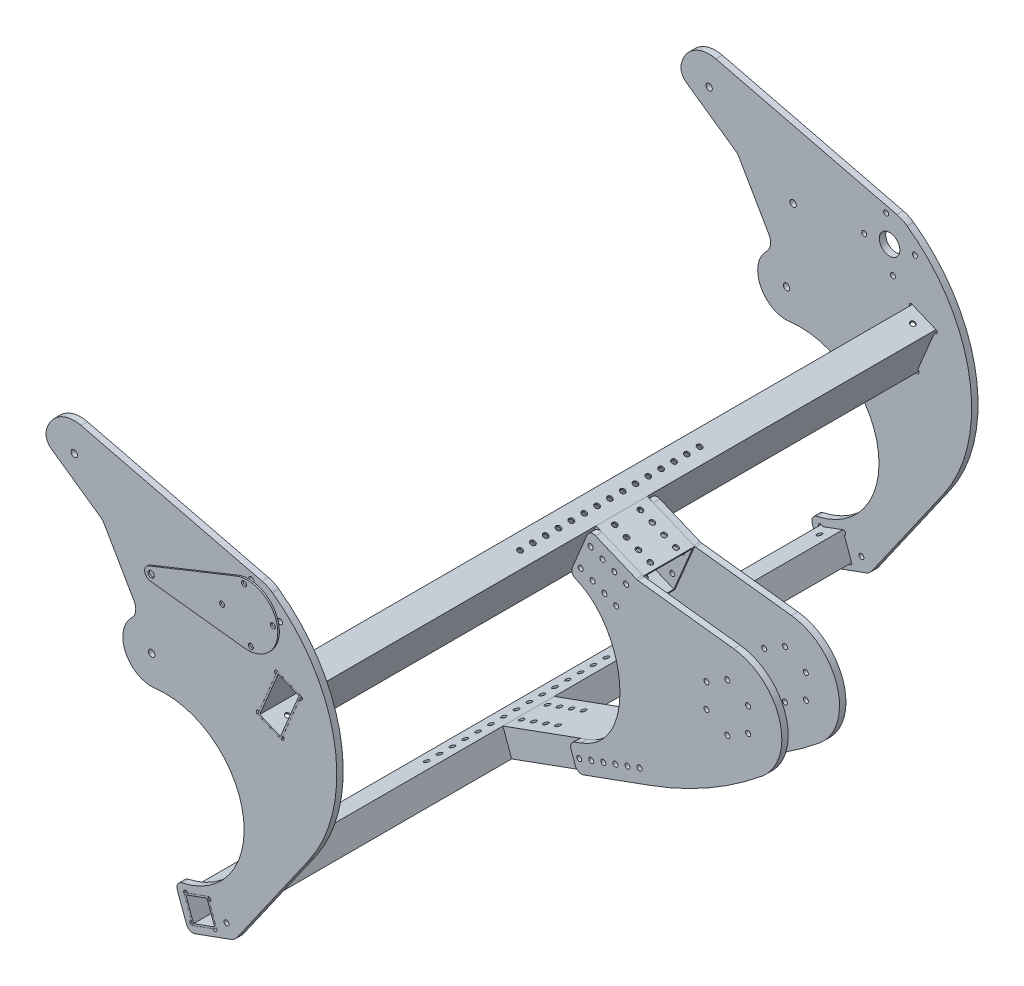
from build123d import *

# Parameters (mm, degrees)
INTAKEPLATE_R         = 2.4892
INTAKEPLATE_R_2       = 3.1877
INTAKEPLATE_R_3       = 10.16
INTAKE_PLATE_DEPTH    = 6.35
ATTACHPLATE_R         = 2.4892
ATTACH_PLATE_DEPTH    = 6.35
FILLET1_R             = 6.35
TUBES_DEPTH           = 317.5
TUBES_2_DEPTH         = 317.5
SHELL1_T              = -1.5875
SHELL2_T              = -1.5875
MOTORPLATE_R          = 3.1877
MOTORPLATE_R_2        = 2.4892
MOTOR_PLATE_DEPTH     = 0.79375
BOSS_EXTRUDE5_DEPTH   = 25.4
BOSS_EXTRUDE5_2_DEPTH = 25.4
SHELL3_T              = -1.5875
SHELL4_T              = -1.5875
SKETCH2_R             = 2.4892
CUT_EXTRUDE1_DEPTH    = 559.862765093
SKETCH3_R             = 2.4892
CUT_EXTRUDE2_DEPTH    = 551.133429097
SKETCH7_R             = 2.4892
CUT_EXTRUDE3_DEPTH    = 578.337440485


with BuildPart() as part:
    # intakeplate → intake plate (new body)
    with BuildSketch(Plane.XY.offset(311.15)):
        with BuildLine():
            Line((-175.094481696, 163.860501271), (-354.210813057, 207.74342033))
            ThreePointArc((-354.210813057, 207.74342033), (-376.184884819, 204.086805854), (-388.681665834, 185.646059572))
            ThreePointArc((-388.681665834, 185.646059572), (-387.982745567, 178.475563628), (-383.495650977, 172.839032447))
            Line((-383.495650977, 172.839032447), (-334.999642146, 138.88176149))
            ThreePointArc((-334.999642146, 138.88176149), (-332.918300109, 137.055971146), (-331.282076853, 134.82252795))
            Line((-331.282076853, 134.82252795), (-301.708711026, 83.535344783))
            ThreePointArc((-301.708711026, 83.535344783), (-300.141023582, 75.376599822), (-303.952427196, 67.994461531))
            ThreePointArc((-303.952427196, 67.994461531), (-310.0444736, 35.013836588), (-280.597550354, 18.960383305))
            ThreePointArc((-280.597550354, 18.960383305), (-193.811320702, -45.167346066), (-254.24067154, -134.568178774))
            ThreePointArc((-254.24067154, -134.568178774), (-258.462337263, -137.704576872), (-258.87162423, -142.947852441))
            Line((-258.87162423, -142.947852441), (-249.732572384, -168.057191023))
            ThreePointArc((-249.732572384, -168.057191023), (-246.449150204, -171.64041756), (-241.593696332, -171.852411255))
            Line((-241.593696332, -171.852411255), (-205.79140748, -158.821443794))
            ThreePointArc((-205.79140748, -158.821443794), (-202.401145166, -156.960902507), (-199.728004521, -154.166298503))
            Line((-199.728004521, -154.166298503), (-128.44973166, -52.256397469))
            ThreePointArc((-128.44973166, -52.256397469), (-103.13948243, 60.921918773), (-164.806500035, 159.141666906))
            ThreePointArc((-164.806500035, 159.141666906), (-169.725931453, 161.99066752), (-175.094481696, 163.860501271))
        make_face()
        with BuildLine():
            Line((-245.202008925, -161.938653884), (-252.487585129, -141.921697774))
            ThreePointArc((-252.487585129, -141.921697774), (-251.232472856, -139.230100819), (-248.5408759, -140.485213092))
            Line((-248.5408759, -140.485213092), (-228.523919791, -133.199636887))
            ThreePointArc((-228.523919791, -133.199636887), (-225.832322835, -134.454749161), (-227.087435109, -137.146346116))
            Line((-227.087435109, -137.146346116), (-219.801858904, -157.163302226))
            ThreePointArc((-219.801858904, -157.163302226), (-221.056971177, -159.854899181), (-223.748568133, -158.599786908))
            Line((-223.748568133, -158.599786908), (-243.765524242, -165.885363113))
            ThreePointArc((-243.765524242, -165.885363113), (-246.457121198, -164.630250839), (-245.202008925, -161.938653884))
        make_face(mode=Mode.SUBTRACT)
        with Locations((-210.135063301, -146.88734751)):
            Circle(INTAKEPLATE_R, mode=Mode.SUBTRACT)
        with Locations((-284.24632, 47.301468413)):
            Circle(INTAKEPLATE_R_2, mode=Mode.SUBTRACT)
        with Locations((-360.934946628, 180.29761311)):
            Circle(INTAKEPLATE_R_2, mode=Mode.SUBTRACT)
        with Locations((-277.709098928, 122.022247177)):
            Circle(INTAKEPLATE_R_2, mode=Mode.SUBTRACT)
        with Locations((-178.884103132, 109.544019413)):
            Circle(INTAKEPLATE_R, mode=Mode.SUBTRACT)
        with BuildLine():
            Line((-159.80685551, 94.370376565), (-136.277395988, 84.53695716))
            ThreePointArc((-136.277395988, 84.53695716), (-135.149557505, 81.789598183), (-137.896916482, 80.6617597))
            Line((-137.896916482, 80.6617597), (-154.285537336, 41.446978444))
            ThreePointArc((-154.285537336, 41.446978444), (-153.157698853, 38.699619467), (-155.90505783, 37.571780984))
            Line((-155.90505783, 37.571780984), (-179.434517351, 47.405200389))
            ThreePointArc((-179.434517351, 47.405200389), (-180.562355834, 50.152559366), (-177.814996857, 51.280397849))
            Line((-177.814996857, 51.280397849), (-161.426376003, 90.495179105))
            ThreePointArc((-161.426376003, 90.495179105), (-162.554214486, 93.242538082), (-159.80685551, 94.370376565))
        make_face(mode=Mode.SUBTRACT)
        with Locations((-207.411487013, 131.373091059)):
            Circle(INTAKEPLATE_R, mode=Mode.SUBTRACT)
        with Locations((-182.23325925, 134.722247177)):
            Circle(INTAKEPLATE_R_3, mode=Mode.SUBTRACT)
        with Locations((-185.582415368, 159.90047494)):
            Circle(INTAKEPLATE_R, mode=Mode.SUBTRACT)
        with Locations((-157.055031487, 138.071403295)):
            Circle(INTAKEPLATE_R, mode=Mode.SUBTRACT)
    extrude(amount=INTAKE_PLATE_DEPTH)


with BuildPart() as body_2:
    # attachplate → attach plate (new body)
    with BuildSketch(Plane.XY.offset(25.4)):
        with BuildLine():
            Line((-89.472422598, 64.92118934), (-136.343855907, 84.509674211))
            Line((-136.343855907, 84.509674211), (-155.932340778, 37.638240902))
            Line((-155.932340778, 37.638240902), (-149.069113064, 34.769964369))
            add(Edge.make_bspline(
                [(-145.015607565, -102.859157154), (-87.182012676, -81.809450074), (-98.933196595, 13.817186978), (-149.069113064, 34.769964369)],
                knots=[0, 0, 0, 0, 0.993372254, 0.993372254, 0.993372254, 0.993372254], degree=3))
            Line((-145.015607565, -102.859157154), (-156.949703849, -107.202812974))
            Line((-156.949703849, -107.202812974), (-148.262392209, -131.071005542))
            Line((-148.262392209, -131.071005542), (-76.657814505, -105.009070621))
            ThreePointArc((-76.657814505, -105.009070621), (-18.496921369, -78.063653207), (34.282473, -41.689479128))
            ThreePointArc((34.282473, -41.689479128), (51.793121281, 15.191221578), (6.332874626, 53.602195141))
            Line((6.332874626, 53.602195141), (-89.472422598, 64.92118934))
        make_face()
        with Locations((-146.638999887, -116.965081348)):
            Circle(ATTACHPLATE_R, mode=Mode.SUBTRACT)
        with Locations((-134.704903603, -112.621425528)):
            Circle(ATTACHPLATE_R, mode=Mode.SUBTRACT)
        with Locations((-122.770807319, -108.277769708)):
            Circle(ATTACHPLATE_R, mode=Mode.SUBTRACT)
        with Locations((-110.836711035, -103.934113888)):
            Circle(ATTACHPLATE_R, mode=Mode.SUBTRACT)
        with Locations((-98.902614751, -99.590458067)):
            Circle(ATTACHPLATE_R, mode=Mode.SUBTRACT)
        with Locations((-86.968518467, -95.246802247)):
            Circle(ATTACHPLATE_R, mode=Mode.SUBTRACT)
        with Locations((0, -23.8125)):
            Circle(ATTACHPLATE_R, mode=Mode.SUBTRACT)
        with Locations((-133.458432069, 42.010417403)):
            Circle(ATTACHPLATE_R, mode=Mode.SUBTRACT)
        with Locations((-145.176290397, 46.90753862)):
            Circle(ATTACHPLATE_R, mode=Mode.SUBTRACT)
        with Locations((-121.740573742, 37.113296185)):
            Circle(ATTACHPLATE_R, mode=Mode.SUBTRACT)
        with Locations((-110.022715415, 32.216174967)):
            Circle(ATTACHPLATE_R, mode=Mode.SUBTRACT)
        with Locations((-135.382047961, 70.343255275)):
            Circle(ATTACHPLATE_R, mode=Mode.SUBTRACT)
        with Locations((-123.664189634, 65.446134057)):
            Circle(ATTACHPLATE_R, mode=Mode.SUBTRACT)
        with Locations((-111.946331306, 60.549012839)):
            Circle(ATTACHPLATE_R, mode=Mode.SUBTRACT)
        with Locations((-100.228472979, 55.651891621)):
            Circle(ATTACHPLATE_R, mode=Mode.SUBTRACT)
        with Locations((-20.622229928, -11.90625)):
            Circle(ATTACHPLATE_R, mode=Mode.SUBTRACT)
        with Locations((-20.622229928, 11.90625)):
            Circle(ATTACHPLATE_R, mode=Mode.SUBTRACT)
        with Locations((0, 23.8125)):
            Circle(ATTACHPLATE_R, mode=Mode.SUBTRACT)
        with Locations((20.622229928, -11.90625)):
            Circle(ATTACHPLATE_R, mode=Mode.SUBTRACT)
        with Locations((20.622229928, 11.90625)):
            Circle(ATTACHPLATE_R, mode=Mode.SUBTRACT)
    extrude(amount=ATTACH_PLATE_DEPTH)

    # Fillet1
    fillet1_edges = [body_2.edges().sort_by_distance(p)[0] for p in [
        (-155.932340778, 37.638240902, 28.575),
        (-136.343855907, 84.509674211, 28.575),
        (-89.472422598, 64.92118934, 28.575),
        (-148.262392209, -131.071005542, 28.575),
        (-156.949703849, -107.202812974, 28.575),
    ]]
    fillet(fillet1_edges, radius=FILLET1_R)


with BuildPart() as body_3:
    # Mirror1: mirrored copy
    add(part.part.mirror(Plane.XY))


with BuildPart() as body_4:
    # Mirror1 2: mirrored copy
    add(body_2.part.mirror(Plane.XY))


with BuildPart() as body_5:
    # citrus are on lsd → tubes (new, symmetric)
    with BuildSketch(Plane.XY):
        Polygon((-252.422474121, -141.952059536), (-228.554281553, -133.264747896), (-219.866969913, -157.132940464), (-243.735162481, -165.820252104), align=None)
    extrude(amount=TUBES_DEPTH, both=True)

    # Shell2
    shell2_openings = [body_5.faces().sort_by_distance(p)[0] for p in [
        (-236.144722017, -149.5425, -317.5),
        (-236.144722017, -149.5425, 317.5),
    ]]
    offset(amount=SHELL2_T, openings=shell2_openings, kind=Kind.INTERSECTION)


with BuildPart() as body_6:
    # citrus are on lsd → tubes 2 (new, symmetric)
    with BuildSketch(Plane.XY):
        Polygon((-179.368057433, 47.432483338), (-155.932340778, 37.638240902), (-136.343855907, 84.509674211), (-159.779572561, 94.303916647), align=None)
    extrude(amount=TUBES_2_DEPTH, both=True)

    # Shell1
    shell1_openings = [body_6.faces().sort_by_distance(p)[0] for p in [
        (-157.85595667, 65.971078775, -317.5),
        (-157.85595667, 65.971078775, 317.5),
    ]]
    offset(amount=SHELL1_T, openings=shell1_openings, kind=Kind.INTERSECTION)


with BuildPart() as body_7:
    # motorplate → motor plate (new, symmetric)
    with BuildSketch(Plane.XY.offset(323.85)):
        with BuildLine():
            Line((-280.066344635, 127.918508083), (-193.369853119, 162.578597865))
            ThreePointArc((-193.369853119, 162.578597865), (-152.495195018, 138.677943372), (-185.700664215, 104.923302574))
            Line((-185.700664215, 104.923302574), (-278.443032981, 115.714803891))
            ThreePointArc((-278.443032981, 115.714803891), (-284.003655869, 121.184958147), (-280.066344635, 127.918508083))
        make_face()
        with Locations((-277.709098928, 122.022247177)):
            Circle(MOTORPLATE_R, mode=Mode.SUBTRACT)
        with Locations((-207.411487013, 131.373091059)):
            Circle(MOTORPLATE_R_2, mode=Mode.SUBTRACT)
        with Locations((-178.884103132, 109.544019413)):
            Circle(MOTORPLATE_R_2, mode=Mode.SUBTRACT)
        with Locations((-157.055031487, 138.071403295)):
            Circle(MOTORPLATE_R_2, mode=Mode.SUBTRACT)
        with Locations((-185.582415368, 159.90047494)):
            Circle(MOTORPLATE_R_2, mode=Mode.SUBTRACT)
    extrude(amount=MOTOR_PLATE_DEPTH, both=True)


with BuildPart() as body_8:
    # citrus are on lsd<3> → Boss-Extrude5 (new, symmetric)
    with BuildSketch(Plane.XY):
        Polygon((-85.345126145, -81.140878053), (-228.554281553, -133.264747896), (-219.866969913, -157.132940464), (-76.657814505, -105.009070621), align=None)
    extrude(amount=BOSS_EXTRUDE5_DEPTH, both=True)

    # Shell4
    shell4_openings = [body_8.faces().sort_by_distance(p)[0] for p in [
        (-81.001470325, -93.074974337, 0),
        (-224.210625733, -145.19884418, 0),
    ]]
    offset(amount=SHELL4_T, openings=shell4_openings, kind=Kind.INTERSECTION)


with BuildPart() as body_9:
    # citrus are on lsd<3> → Boss-Extrude5 2 (new, symmetric)
    with BuildSketch(Plane.XY):
        Polygon((-136.343855907, 84.509674211), (-155.932340778, 37.638240902), (-109.060907469, 18.049756031), (-89.472422598, 64.92118934), align=None)
    extrude(amount=BOSS_EXTRUDE5_2_DEPTH, both=True)

    # Shell3
    shell3_openings = [body_9.faces().sort_by_distance(p)[0] for p in [
        (-146.138098342, 61.073957557, 0),
        (-99.266665033, 41.485472685, 0),
    ]]
    offset(amount=SHELL3_T, openings=shell3_openings, kind=Kind.INTERSECTION)


with BuildPart() as cut_extrude1_tool:
    # Sketch2 → Cut-Extrude1 (new, through all)
    with BuildSketch(Plane.XY.offset(25.4)):
        with Locations((-134.704903603, -112.621425528)):
            Circle(SKETCH2_R)
        with Locations((-146.638999887, -116.965081348)):
            Circle(SKETCH2_R)
        with Locations((-122.770807319, -108.277769708)):
            Circle(SKETCH2_R)
        with Locations((-110.836711035, -103.934113888)):
            Circle(SKETCH2_R)
        with Locations((-98.902614751, -99.590458067)):
            Circle(SKETCH2_R)
        with Locations((-86.968518467, -95.246802247)):
            Circle(SKETCH2_R)
        with Locations((-145.176290397, 46.90753862)):
            Circle(SKETCH2_R)
        with Locations((-133.458432069, 42.010417403)):
            Circle(SKETCH2_R)
        with Locations((-110.022715415, 32.216174967)):
            Circle(SKETCH2_R)
        with Locations((-121.740573742, 37.113296185)):
            Circle(SKETCH2_R)
        with Locations((-100.228472979, 55.651891621)):
            Circle(SKETCH2_R)
        with Locations((-111.946331306, 60.549012839)):
            Circle(SKETCH2_R)
        with Locations((-123.664189634, 65.446134057)):
            Circle(SKETCH2_R)
        with Locations((-135.382047961, 70.343255275)):
            Circle(SKETCH2_R)
    extrude(amount=-CUT_EXTRUDE1_DEPTH)


with BuildPart() as body_8_1:
    add(body_8.part)

    # Cut-Extrude1: cut by cut_extrude1_tool
    add(cut_extrude1_tool.part, mode=Mode.SUBTRACT)


with BuildPart() as body_9_1:
    add(body_9.part)

    # Cut-Extrude1: cut by cut_extrude1_tool
    add(cut_extrude1_tool.part, mode=Mode.SUBTRACT)


with BuildPart() as cut_extrude2_tool:
    # Sketch3 → Cut-Extrude2 (new, through all)
    with BuildSketch(Plane(origin=(9.794242436, 23.435716654, 0), x_dir=(0.9226660100193758, -0.38560009589589733, 0), z_dir=(0.38560009589589733, 0.9226660100193758, 0))):
        with Locations((-152.03678, -12.7)):
            Circle(SKETCH3_R)
        with Locations((-152.03678, 12.7)):
            Circle(SKETCH3_R)
        with Locations((-171.08678, -88.9)):
            Circle(SKETCH3_R)
        with Locations((-171.08678, -76.2)):
            Circle(SKETCH3_R)
        with Locations((-171.08678, -63.5)):
            Circle(SKETCH3_R)
        with Locations((-171.08678, -50.8)):
            Circle(SKETCH3_R)
        with Locations((-171.08678, -38.1)):
            Circle(SKETCH3_R)
        with Locations((-171.08678, -25.4)):
            Circle(SKETCH3_R)
        with Locations((-171.08678, -12.7)):
            Circle(SKETCH3_R)
        with Locations((-171.08678, 0)):
            Circle(SKETCH3_R)
        with Locations((-171.08678, 12.7)):
            Circle(SKETCH3_R)
        with Locations((-171.08678, 25.4)):
            Circle(SKETCH3_R)
        with Locations((-171.08678, 38.1)):
            Circle(SKETCH3_R)
        with Locations((-171.08678, 50.8)):
            Circle(SKETCH3_R)
        with Locations((-139.33678, -12.7)):
            Circle(SKETCH3_R)
        with Locations((-139.33678, 12.7)):
            Circle(SKETCH3_R)
        with Locations((-126.63678, -12.7)):
            Circle(SKETCH3_R)
        with Locations((-126.63678, 12.7)):
            Circle(SKETCH3_R)
        with Locations((-113.93678, -12.7)):
            Circle(SKETCH3_R)
        with Locations((-113.93678, 12.7)):
            Circle(SKETCH3_R)
        with Locations((-171.08678, 63.5)):
            Circle(SKETCH3_R)
        with Locations((-171.08678, 76.2)):
            Circle(SKETCH3_R)
        with Locations((-171.08678, 88.9)):
            Circle(SKETCH3_R)
        with Locations((-171.08678, -300.0375)):
            Circle(SKETCH3_R)
        with Locations((-171.08678, 300.0375)):
            Circle(SKETCH3_R)
    extrude(amount=-CUT_EXTRUDE2_DEPTH)


with BuildPart() as body_6_1:
    add(body_6.part)

    # Cut-Extrude2: cut by cut_extrude2_tool
    add(cut_extrude2_tool.part, mode=Mode.SUBTRACT)


with BuildPart() as body_9_2:
    add(body_9_1.part)

    # Cut-Extrude2: cut by cut_extrude2_tool
    add(cut_extrude2_tool.part, mode=Mode.SUBTRACT)


with BuildPart() as cut_extrude3_tool:
    # Sketch7 → Cut-Extrude3 (new, through all)
    with BuildSketch(Plane(origin=(16.094692269, -44.219803581, 0), x_dir=(0.9396926207859086, 0.34202014332566805, 0), z_dir=(-0.34202014332566805, 0.9396926207859086, 0))):
        with Locations((-254, -12.7)):
            Circle(SKETCH7_R)
        with Locations((-254, 12.7)):
            Circle(SKETCH7_R)
        with Locations((-273.05, -88.9)):
            Circle(SKETCH7_R)
        with Locations((-273.05, -76.2)):
            Circle(SKETCH7_R)
        with Locations((-273.05, -63.5)):
            Circle(SKETCH7_R)
        with Locations((-273.05, -50.8)):
            Circle(SKETCH7_R)
        with Locations((-273.05, -38.1)):
            Circle(SKETCH7_R)
        with Locations((-273.05, -25.4)):
            Circle(SKETCH7_R)
        with Locations((-273.05, -12.7)):
            Circle(SKETCH7_R)
        with Locations((-273.05, 0)):
            Circle(SKETCH7_R)
        with Locations((-273.05, 12.7)):
            Circle(SKETCH7_R)
        with Locations((-273.05, 25.4)):
            Circle(SKETCH7_R)
        with Locations((-273.05, 38.1)):
            Circle(SKETCH7_R)
        with Locations((-273.05, 50.8)):
            Circle(SKETCH7_R)
        with Locations((-273.05, 63.5)):
            Circle(SKETCH7_R)
        with Locations((-273.05, 76.2)):
            Circle(SKETCH7_R)
        with Locations((-273.05, 88.9)):
            Circle(SKETCH7_R)
        with Locations((-241.3, 12.7)):
            Circle(SKETCH7_R)
        with Locations((-241.3, -12.7)):
            Circle(SKETCH7_R)
        with Locations((-228.6, 12.7)):
            Circle(SKETCH7_R)
        with Locations((-228.6, -12.7)):
            Circle(SKETCH7_R)
        with Locations((-215.9, 12.7)):
            Circle(SKETCH7_R)
        with Locations((-215.9, -12.7)):
            Circle(SKETCH7_R)
        with Locations((-273.05, -300.0375)):
            Circle(SKETCH7_R)
        with Locations((-273.05, 300.0375)):
            Circle(SKETCH7_R)
    extrude(amount=-CUT_EXTRUDE3_DEPTH)


with BuildPart() as body_5_1:
    add(body_5.part)

    # Cut-Extrude3: cut by cut_extrude3_tool
    add(cut_extrude3_tool.part, mode=Mode.SUBTRACT)


with BuildPart() as body_8_2:
    add(body_8_1.part)

    # Cut-Extrude3: cut by cut_extrude3_tool
    add(cut_extrude3_tool.part, mode=Mode.SUBTRACT)


solid = Compound([part.part, body_2.part, body_3.part, body_4.part, body_7.part, body_6_1.part, body_9_2.part, body_5_1.part, body_8_2.part])
